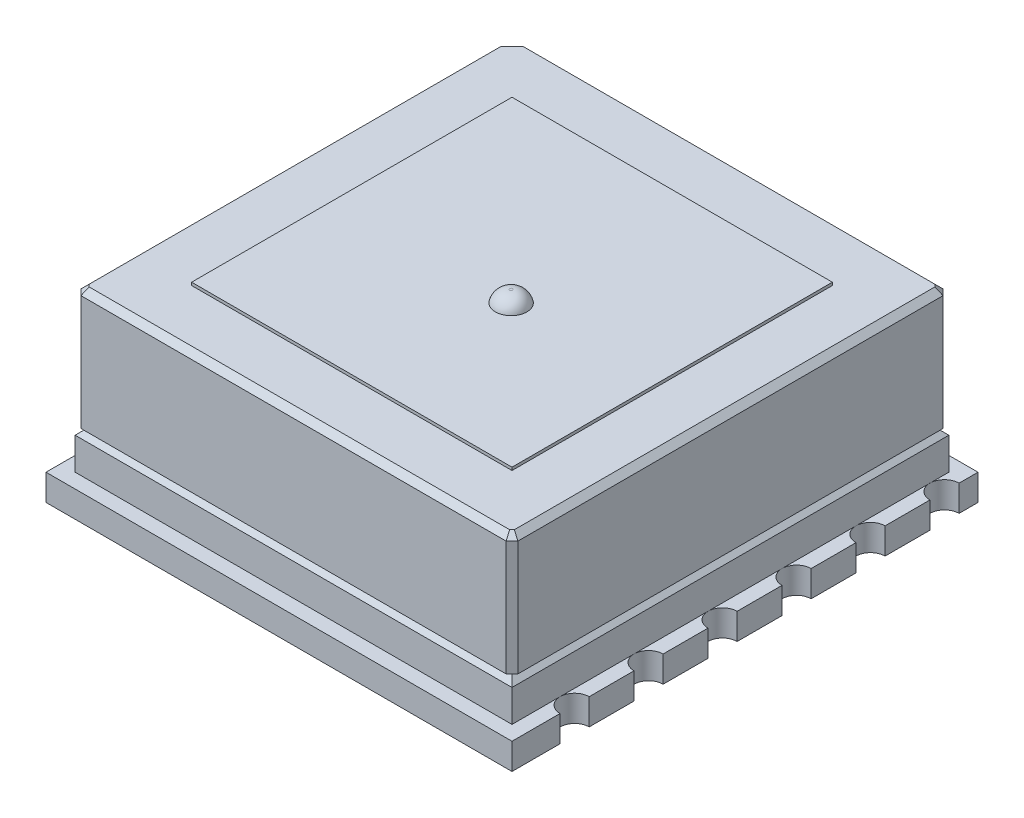
from build123d import *

# Parameters (mm, degrees)
EXTRUDE1_DEPTH = 0.9
SKETCH2_W      = 15
SKETCH2_H      = 15
EXTRUDE2_DEPTH = 1.4
CHAMFER1_SIZE  = 0.3
SKETCH3_W      = 15
SKETCH3_H      = 15
EXTRUDE3_DEPTH = 4.15
CHAMFER2_SIZE  = 0.5
CHAMFER3_SIZE  = 0.2
CHAMFER4_SIZE  = 0.2
SKETCH4_R      = 0.55
EXTRUDE4_DEPTH = 0.5
FILLET1_R      = 0.5
SKETCH5_W      = 11
SKETCH5_H      = 11
EXTRUDE5_DEPTH = 0.1


with BuildPart() as part:
    # Sketch1 → Extrude1 (new body)
    with BuildSketch(Plane(origin=(0, 0, 0), x_dir=(1, 0, 0), z_dir=(0, 1, 0))):
        with BuildLine():
            Line((8, 6.35), (8, 4.81))
            ThreePointArc((8, 4.81), (7.5, 4.31), (8, 3.81))
            Line((8, 3.81), (8, 2.27))
            ThreePointArc((8, 2.27), (7.5, 1.77), (8, 1.27))
            Line((8, 1.27), (8, -0.27))
            ThreePointArc((8, -0.27), (7.5, -0.77), (8, -1.27))
            Line((8, -1.27), (8, -2.81))
            ThreePointArc((8, -2.81), (7.5, -3.31), (8, -3.81))
            Line((8, -3.81), (8, -5.35))
            ThreePointArc((8, -5.35), (7.5, -5.85), (8, -6.35))
            Line((8, -6.35), (8, -8))
            Line((8, -8), (-8, -8))
            Line((-8, -8), (-8, -6.35))
            ThreePointArc((-8, -6.35), (-7.5, -5.85), (-8, -5.35))
            Line((-8, -5.35), (-8, -3.81))
            ThreePointArc((-8, -3.81), (-7.5, -3.31), (-8, -2.81))
            Line((-8, -2.81), (-8, -1.27))
            ThreePointArc((-8, -1.27), (-7.5, -0.77), (-8, -0.27))
            Line((-8, -0.27), (-8, 1.27))
            ThreePointArc((-8, 1.27), (-7.5, 1.77), (-8, 2.27))
            Line((-8, 2.27), (-8, 3.81))
            ThreePointArc((-8, 3.81), (-7.5, 4.31), (-8, 4.81))
            Line((-8, 4.81), (-8, 6.35))
            ThreePointArc((-8, 6.35), (-7.5, 6.85), (-8, 7.35))
            Line((-8, 7.35), (-8, 8))
            Line((-8, 8), (8, 8))
            Line((8, 8), (8, 7.35))
            ThreePointArc((8, 7.35), (7.5, 6.85), (8, 6.35))
        make_face()
    extrude(amount=EXTRUDE1_DEPTH)

    # Sketch2 → Extrude2 (add)
    with BuildSketch(Plane(origin=(0, 0.9, 0), x_dir=(1, 0, 0), z_dir=(0, 1, 0))):
        Rectangle(SKETCH2_W, SKETCH2_H)
    extrude(amount=EXTRUDE2_DEPTH)

    # Chamfer1
    chamfer1_edges = [part.edges().sort_by_distance(p)[0] for p in [
        (-7.5, 2.3, 0),
        (0, 2.3, 7.5),
        (7.5, 2.3, 0),
        (0, 2.3, -7.5),
    ]]
    chamfer(chamfer1_edges, length=CHAMFER1_SIZE)

    # Sketch3 → Extrude3 (add)
    with BuildSketch(Plane(origin=(0, 2.3, 0), x_dir=(1, 0, 0), z_dir=(0, 1, 0))):
        Rectangle(SKETCH3_W, SKETCH3_H)
    extrude(amount=EXTRUDE3_DEPTH)

    # Chamfer2
    chamfer2_edges = [part.edges().sort_by_distance(p)[0] for p in [
        (-7.5, 4.375, -7.5),
    ]]
    chamfer(chamfer2_edges, length=CHAMFER2_SIZE)

    # Chamfer3
    chamfer3_edges = [part.edges().sort_by_distance(p)[0] for p in [
        (-7.5, 4.375, 7.5),
        (7.5, 4.375, 7.5),
        (7.5, 4.375, -7.5),
    ]]
    chamfer(chamfer3_edges, length=CHAMFER3_SIZE)

    # Chamfer4
    chamfer4_edges = [part.edges().sort_by_distance(p)[0] for p in [
        (-7.5, 6.45, 0.15),
        (-7.25, 6.45, -7.25),
        (0.15, 6.45, -7.5),
        (7.5, 6.45, 0),
        (0, 6.45, 7.5),
        (-7.4, 6.45, 7.4),
        (7.4, 6.45, 7.4),
        (7.4, 6.45, -7.4),
    ]]
    chamfer(chamfer4_edges, length=CHAMFER4_SIZE)

    # Sketch4 → Extrude4 (add)
    with BuildSketch(Plane(origin=(0, 6.45, 0), x_dir=(1, 0, 0), z_dir=(0, 1, 0))):
        with Locations(Location((0.6, -0.63, 0), (0, 0, 270))):
            Circle(SKETCH4_R)
    extrude(amount=EXTRUDE4_DEPTH)

    # Fillet1
    fillet1_edges = [part.edges().sort_by_distance(p)[0] for p in [
        (0.6, 6.95, 0.08),
    ]]
    fillet(fillet1_edges, radius=FILLET1_R - 0.0001)  # a hair under: the kernel refuses the full size

    # Sketch5 → Extrude5 (add)
    with BuildSketch(Plane(origin=(0, 6.45, 0), x_dir=(1, 0, 0), z_dir=(0, 1, 0))):
        Rectangle(SKETCH5_W, SKETCH5_H)
    extrude(amount=EXTRUDE5_DEPTH)


solid = part.part
